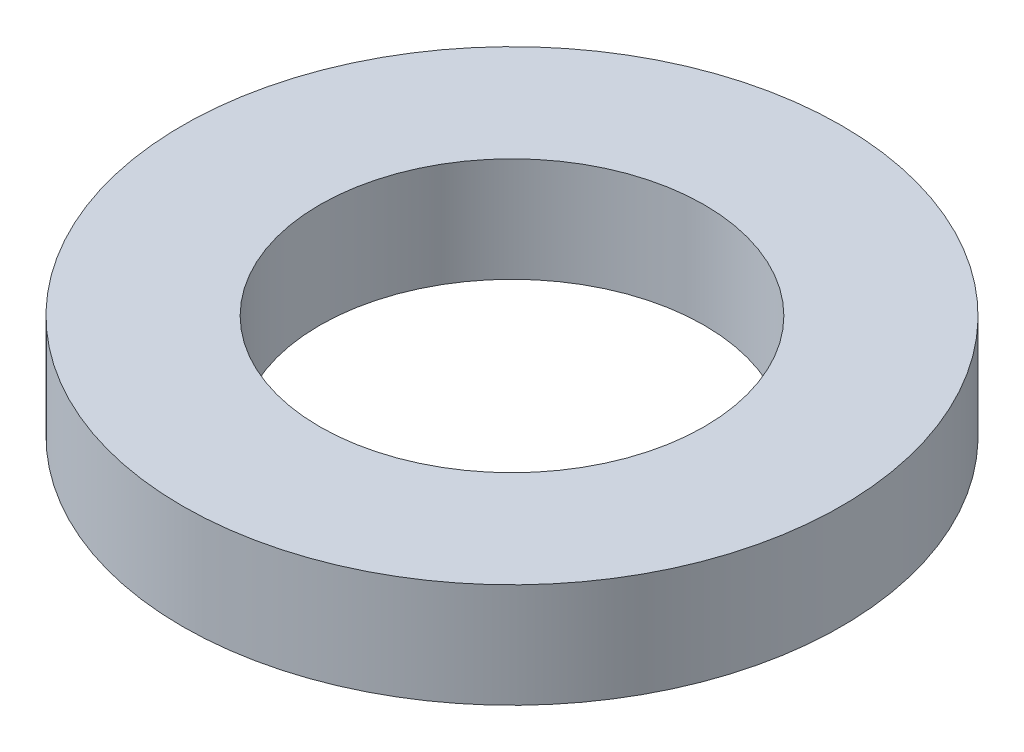
from build123d import *

# Parameters (mm, degrees)
SKETCH1_R           = 60
BOSS_EXTRUDE1_DEPTH = 19
SKETCH2_R           = 35
CUT_EXTRUDE1_DEPTH  = 87.954010833


with BuildPart() as part:
    # Sketch1 → Boss-Extrude1 (new body)
    with BuildSketch(Plane(origin=(0, 0, 0), x_dir=(1, 0, 0), z_dir=(0, 1, 0))):
        Circle(SKETCH1_R)
    extrude(amount=BOSS_EXTRUDE1_DEPTH)

    # Sketch2 → Cut-Extrude1 (cut, through all)
    with BuildSketch(Plane(origin=(0, 0, 0), x_dir=(1, 0, 0), z_dir=(0, 1, 0))):
        Circle(SKETCH2_R)
    extrude(amount=CUT_EXTRUDE1_DEPTH, mode=Mode.SUBTRACT)


solid = part.part
